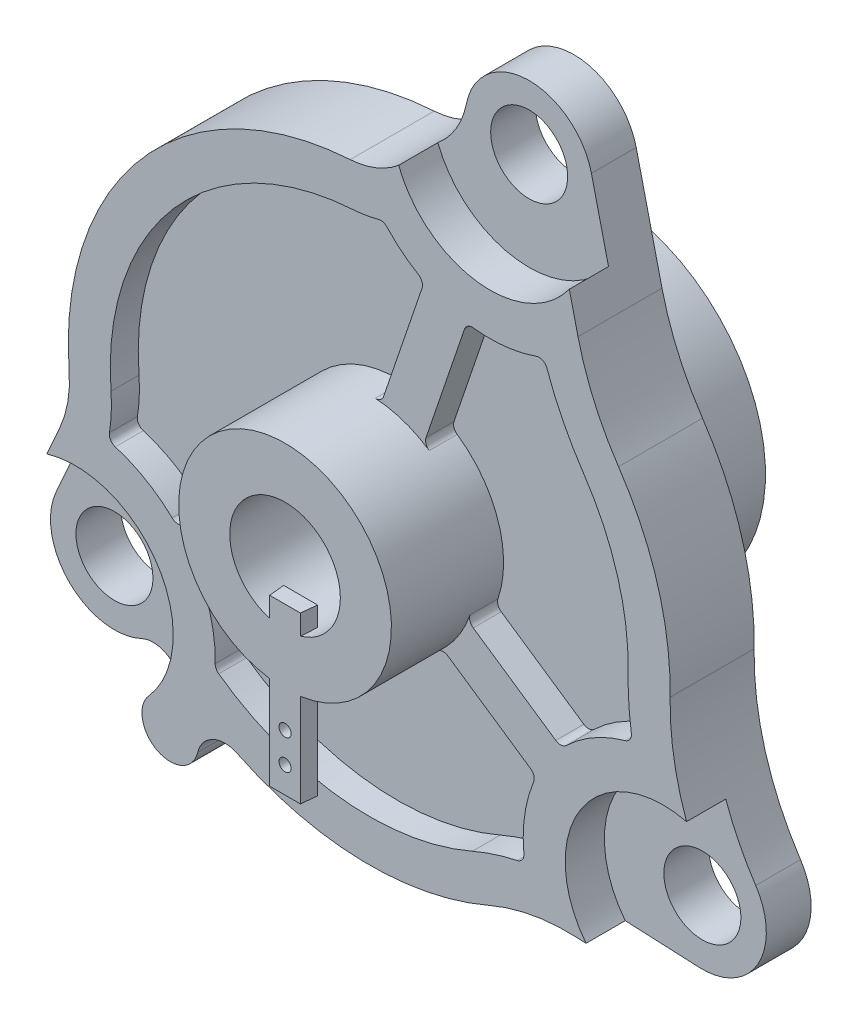
from build123d import *

# Parameters (mm, degrees)
EXTRUDE_START           = -5.08
EXTRUDE_1_OUTLINE_R     = 5.0165
EXTRUDE_1_DEPTH         = 5.08
EXTRUDE_1_2_OUTLINE_R   = 14.588011588
EXTRUDE_1_2_OUTLINE_R_2 = 2.268804718
EXTRUDE_1_2_OUTLINE_R_3 = 5.0165
EXTRUDE_1_2_OUTLINE_R_4 = 1.7
EXTRUDE_1_2_DEPTH       = 13.745
EXTRUDE_START_2         = -7.62
EXTRUDE_1_3_OUTLINE_R   = 5.0165
EXTRUDE_1_3_DEPTH       = 2.54
EXTRUDE_START_3         = -15.255
EXTRUDE_1_4_OUTLINE_R   = 9.652
EXTRUDE_1_4_OUTLINE_R_2 = 5.0165
EXTRUDE_1_4_DEPTH       = 7.635
EXTRUDE_START_4         = -4.064
EXTRUDE_1_5_OUTLINE_R   = 3.4925
EXTRUDE_1_5_DEPTH       = 4.064
SKETCH_2_R              = 3.139837575
SKETCH_2_R_2            = 1.7
EXTRUDE_2_DEPTH         = 13.745
SKETCH_3_R              = 1.2
CUT_EXTRUDE_1_DEPTH     = 2
SKETCH_4_R              = 2.8
SKETCH_4_R_2            = 1.7
EXTRUDE_3_DEPTH         = 3
CUT_EXTRUDE_2_DEPTH     = 11
EXTRUDE_4_DEPTH         = 7
EXTRUDE_4_DEPTH_BACK    = 8
SKETCH_8_R              = 0.55
CUT_EXTRUDE_3_DEPTH     = 7


with BuildPart() as part:
    # 凸台-拉伸1: read off the stored shape, not the designer's step
    # 凸台-拉伸1 outline → 凸台-拉伸1 (new body)
    with BuildSketch(Plane(origin=(0, 0, 0), x_dir=(-1, 0, 0), z_dir=(0, 0, -1)).offset(EXTRUDE_START)):
        with BuildLine():
            ThreePointArc((20.001041548, -24.024868384), (19.189851545, -13.342229592), (29.241937464, -9.636508412))
            Line((29.241937464, -9.636508412), (28.068905544, -6.994505511))
            ThreePointArc((28.068905544, -6.994505511), (27.342210837, -4.596155707), (27.224673499, -2.092887453))
            ThreePointArc((27.224673499, -2.092887453), (20.610396453, 17.910180989), (1.725707135, 27.250412105))
            ThreePointArc((1.725707135, 27.250412105), (-0.612060573, 27.775940536), (-2.671053319, 29.001455474))
            ThreePointArc((-2.671053319, 29.001455474), (-9.820841475, 23.407165066), (-18.154679086, 27.007540952))
            Line((-18.154679086, 27.007540952), (-18.943472312, 23.673588932))
            ThreePointArc((-18.943472312, 23.673588932), (-20.401103388, 19.31706117), (-22.619598737, 15.294338102))
            ThreePointArc((-22.619598737, 15.294338102), (-26.177171365, 7.766513011), (-27.300719551, -0.483463539))
            ThreePointArc((-27.300719551, -0.483463539), (-27.635164342, -5.065694963), (-28.789587413, -9.512717058))
            ThreePointArc((-28.789587413, -9.512717058), (-19.201342403, -13.324384855), (-19.674042111, -23.631654559))
            Line((-19.674042111, -23.631654559), (-18.789002246, -23.590560073))
            ThreePointArc((-18.789002246, -23.590560073), (-14.751162948, -23.864172006), (-10.879801534, -25.043820467))
            ThreePointArc((-10.879801534, -25.043820467), (0.599616353, -27.298415434), (11.968964894, -24.54194174))
            ThreePointArc((11.968964894, -24.54194174), (14.170803819, -24.529943899), (15.554698359, -26.242566013))
            ThreePointArc((15.554698359, -26.242566013), (18.332802908, -28.204355062), (20.616984936, -25.68463412))
            ThreePointArc((20.616984936, -25.68463412), (20.463088042, -24.797573692), (20.001041548, -24.024868384))
        make_face()
        Circle(EXTRUDE_1_OUTLINE_R, mode=Mode.SUBTRACT)
    extrude(amount=EXTRUDE_1_DEPTH)

    # Extrude 1 2 outline → Extrude 1 2 (add)
    with BuildSketch(Plane(origin=(0, 0, 0), x_dir=(-1, 0, 0), z_dir=(0, 0, -1))):
        Circle(EXTRUDE_1_2_OUTLINE_R)
        with Locations((-9.916654285, 0)):
            Circle(EXTRUDE_1_2_OUTLINE_R_2, mode=Mode.SUBTRACT)
        Circle(EXTRUDE_1_2_OUTLINE_R_3, mode=Mode.SUBTRACT)
        with Locations((9.916654285, 0)):
            Circle(EXTRUDE_1_2_OUTLINE_R_4, mode=Mode.SUBTRACT)
    extrude(amount=EXTRUDE_1_2_DEPTH)

    # Extrude 1 3 outline → Extrude 1 3 (add)
    with BuildSketch(Plane(origin=(0, 0, 0), x_dir=(-1, 0, 0), z_dir=(0, 0, -1)).offset(EXTRUDE_START_2)):
        with BuildLine():
            ThreePointArc((20.001041548, -24.024868384), (19.189851545, -13.342229592), (29.241937464, -9.636508412))
            Line((29.241937464, -9.636508412), (28.068905544, -6.994505511))
            ThreePointArc((28.068905544, -6.994505511), (27.342210837, -4.596155707), (27.224673499, -2.092887453))
            ThreePointArc((27.224673499, -2.092887453), (20.610396453, 17.910180989), (1.725707135, 27.250412105))
            ThreePointArc((1.725707135, 27.250412105), (-0.612060573, 27.775940536), (-2.671053319, 29.001455474))
            ThreePointArc((-2.671053319, 29.001455474), (-9.820841475, 23.407165066), (-18.154679086, 27.007540952))
            Line((-18.154679086, 27.007540952), (-18.943472312, 23.673588932))
            ThreePointArc((-18.943472312, 23.673588932), (-20.401103388, 19.31706117), (-22.619598737, 15.294338102))
            ThreePointArc((-22.619598737, 15.294338102), (-26.177171365, 7.766513011), (-27.300719551, -0.483463539))
            ThreePointArc((-27.300719551, -0.483463539), (-27.635164342, -5.065694963), (-28.789587413, -9.512717058))
            ThreePointArc((-28.789587413, -9.512717058), (-19.201342403, -13.324384855), (-19.674042111, -23.631654559))
            Line((-19.674042111, -23.631654559), (-18.789002246, -23.590560073))
            ThreePointArc((-18.789002246, -23.590560073), (-14.751162948, -23.864172006), (-10.879801534, -25.043820467))
            ThreePointArc((-10.879801534, -25.043820467), (0.599616353, -27.298415434), (11.968964894, -24.54194174))
            ThreePointArc((11.968964894, -24.54194174), (14.170803819, -24.529943899), (15.554698359, -26.242566013))
            ThreePointArc((15.554698359, -26.242566013), (18.332802908, -28.204355062), (20.616984936, -25.68463412))
            ThreePointArc((20.616984936, -25.68463412), (20.463088042, -24.797573692), (20.001041548, -24.024868384))
        make_face()
        with BuildLine():
            Line((-9.437411967, -3.963488283), (-16.925432177, -9.058357516))
            ThreePointArc((-16.925432177, -9.058357516), (-17.41757272, -9.187708174), (-17.881401777, -8.978432009))
            ThreePointArc((-17.881401777, -8.978432009), (-20.369392498, -7.119448331), (-23.234189867, -5.919925851))
            ThreePointArc((-23.234189867, -5.919925851), (-23.66657971, -5.602168652), (-23.782330153, -5.07821021))
            ThreePointArc((-23.782330153, -5.07821021), (-23.543476187, -2.752933566), (-23.491316823, -0.41600351))
            ThreePointArc((-23.491316823, -0.41600351), (-22.524542802, 6.682813521), (-19.463375657, 13.160244413))
            ThreePointArc((-19.463375657, 13.160244413), (-17.583975546, 16.360762601), (-16.125595223, 19.773765426))
            ThreePointArc((-16.125595223, 19.773765426), (-15.736516696, 20.206674843), (-15.155334867, 20.23861769))
            ThreePointArc((-15.155334867, 20.23861769), (-12.339759376, 19.599936809), (-9.452686504, 19.613679036))
            ThreePointArc((-9.452686504, 19.613679036), (-8.956292025, 19.50175751), (-8.641029977, 19.102328233))
            Line((-8.641029977, 19.102328233), (-5.153233585, 8.844103551))
            ThreePointArc((-5.153233585, 8.844103551), (-5.151801591, 8.357776579), (-5.444820191, 7.96963218))
            ThreePointArc((-5.444820191, 7.96963218), (-9.153474063, 3.061864885), (-9.144158429, -3.089574506))
            ThreePointArc((-9.144158429, -3.089574506), (-9.143653777, -3.575903324), (-9.437411967, -3.963488283))
        make_face(mode=Mode.SUBTRACT)
        with BuildLine():
            ThreePointArc((-7.151258866, -7.323488283), (-6.682895498, -7.19252367), (-6.230707221, -7.371525726))
            ThreePointArc((-6.230707221, -7.371525726), (0, -9.652), (6.230707221, -7.371525726))
            ThreePointArc((6.230707221, -7.371525726), (6.682895498, -7.19252367), (7.151258866, -7.323488283))
            Line((7.151258866, -7.323488283), (14.639279076, -12.418357516))
            ThreePointArc((14.639279076, -12.418357516), (14.940264662, -12.828652024), (14.91587299, -13.336922575))
            ThreePointArc((14.91587299, -13.336922575), (14.177670379, -15.859049125), (13.97436048, -18.4791122))
            ThreePointArc((13.97436048, -18.4791122), (13.89467208, -18.838860561), (13.655503297, -19.119159362))
            ThreePointArc((13.655503297, -19.119159362), (2.466910188, -23.365131695), (-9.361689692, -21.54933389))
            ThreePointArc((-9.361689692, -21.54933389), (-11.36623515, -20.794349539), (-13.435727078, -20.241713106))
            ThreePointArc((-13.435727078, -20.241713106), (-13.891836222, -19.945284024), (-14.034051192, -19.420231022))
            ThreePointArc((-14.034051192, -19.420231022), (-14.101364036, -16.324420921), (-14.91587299, -13.336922575))
            ThreePointArc((-14.91587299, -13.336922575), (-14.940264662, -12.828652024), (-14.639279076, -12.418357516))
            Line((-14.639279076, -12.418357516), (-7.151258866, -7.323488283))
        make_face(mode=Mode.SUBTRACT)
        with BuildLine():
            Line((16.925432177, -9.058357516), (9.437411967, -3.963488283))
            ThreePointArc((9.437411967, -3.963488283), (9.143653777, -3.575903324), (9.144158429, -3.089574506))
            ThreePointArc((9.144158429, -3.089574506), (7.680637088, 5.845418541), (-0.541368686, 9.636805692))
            ThreePointArc((-0.541368686, 9.636805692), (-1.010249862, 9.765904167), (-1.30554915, 10.152316259))
            Line((-1.30554915, 10.152316259), (-4.793345542, 20.410540941))
            ThreePointArc((-4.793345542, 20.410540941), (-4.786886375, 20.919355432), (-4.461586411, 21.310653068))
            ThreePointArc((-4.461586411, 21.310653068), (-2.953099663, 22.36336928), (-1.612513688, 23.62296165))
            ThreePointArc((-1.612513688, 23.62296165), (-1.26105352, 23.839608177), (-0.848188408, 23.841146693))
            ThreePointArc((-0.848188408, 23.841146693), (0.308161985, 23.584056969), (1.484910791, 23.44802902))
            ThreePointArc((1.484910791, 23.44802902), (17.73452718, 15.411085967), (23.425881848, -1.800856645))
            ThreePointArc((23.425881848, -1.800856645), (23.397483591, -3.467160777), (23.567714628, -5.124989875))
            ThreePointArc((23.567714628, -5.124989875), (23.461621487, -5.65215236), (23.033860973, -5.978000458))
            ThreePointArc((23.033860973, -5.978000458), (20.279055523, -7.17155875), (17.881401777, -8.978432009))
            ThreePointArc((17.881401777, -8.978432009), (17.41757272, -9.187708174), (16.925432177, -9.058357516))
        make_face(mode=Mode.SUBTRACT)
        Circle(EXTRUDE_1_3_OUTLINE_R, mode=Mode.SUBTRACT)
    extrude(amount=EXTRUDE_1_3_DEPTH)

    # Extrude 1 4 outline → Extrude 1 4 (add)
    with BuildSketch(Plane(origin=(0, 0, 0), x_dir=(-1, 0, 0), z_dir=(0, 0, -1)).offset(EXTRUDE_START_3)):
        Circle(EXTRUDE_1_4_OUTLINE_R)
        Circle(EXTRUDE_1_4_OUTLINE_R_2, mode=Mode.SUBTRACT)
    extrude(amount=EXTRUDE_1_4_DEPTH)

    # Extrude 1 5 outline → Extrude 1 5 (add)
    # profile 1 of 3: a face of its own
    with BuildSketch(Plane(origin=(0, 0, 0), x_dir=(-1, 0, 0), z_dir=(0, 0, -1)).offset(EXTRUDE_START_4)):
        with BuildLine():
            Line((31.974558392, -15.791151184), (29.241937464, -9.636508412))
            ThreePointArc((29.241937464, -9.636508412), (19.189851545, -13.342229592), (20.001041548, -24.024868384))
            ThreePointArc((20.001041548, -24.024868384), (20.463088042, -24.797573692), (20.616984936, -25.68463412))
            ThreePointArc((20.616984936, -25.68463412), (21.802856471, -23.565523811), (24.226273175, -23.410697217))
            ThreePointArc((24.226273175, -23.410697217), (30.739454478, -22.284551863), (31.974558392, -15.791151184))
        make_face()
        with Locations((26.67, -18.146340237)):
            Circle(EXTRUDE_1_5_OUTLINE_R, mode=Mode.SUBTRACT)
    # profile 2 of 3: a face of its own
    with BuildSketch(Plane(origin=(0, 0, 0), x_dir=(-1, 0, 0), z_dir=(0, 0, -1)).offset(EXTRUDE_START_4)):
        with BuildLine():
            ThreePointArc((-18.154679086, 27.007540952), (-9.820841475, 23.407165066), (-2.671053319, 29.001455474))
            ThreePointArc((-2.671053319, 29.001455474), (-4.34154767, 30.95941179), (-5.264931729, 33.361807717))
            ThreePointArc((-5.264931729, 33.361807717), (-10.854529977, 38.027365143), (-16.604256141, 33.560634381))
            Line((-16.604256141, 33.560634381), (-18.154679086, 27.007540952))
        make_face()
        with Locations((-10.956281429, 32.224357143)):
            Circle(EXTRUDE_1_5_OUTLINE_R, mode=Mode.SUBTRACT)
    # profile 3 of 3: a face of its own
    with BuildSketch(Plane(origin=(0, 0, 0), x_dir=(-1, 0, 0), z_dir=(0, 0, -1)).offset(EXTRUDE_START_4)):
        with BuildLine():
            Line((-26.400801283, -23.943993837), (-19.674042111, -23.631654559))
            ThreePointArc((-19.674042111, -23.631654559), (-19.201342403, -13.324384855), (-28.789587413, -9.512717058))
            ThreePointArc((-28.789587413, -9.512717058), (-29.987271524, -12.310373526), (-31.510952034, -14.944709618))
            ThreePointArc((-31.510952034, -14.944709618), (-31.716980405, -21.01221602), (-26.400801283, -23.943993837))
        make_face()
        with Locations((-26.67, -18.146340237)):
            Circle(EXTRUDE_1_5_OUTLINE_R, mode=Mode.SUBTRACT)
    extrude(amount=EXTRUDE_1_5_DEPTH)

    # 草图2 → 凸台-拉伸2 (add)
    with BuildSketch(Plane(origin=(0, 0, 0), x_dir=(-1, 0, 0), z_dir=(0, 0, -1))):
        with Locations((-9.916654285, 0)):
            Circle(SKETCH_2_R)
        with Locations(Location((-9.916654285, 0, 0), (0, 0, 180))):
            Circle(SKETCH_2_R_2, mode=Mode.SUBTRACT)
    extrude(amount=EXTRUDE_2_DEPTH)

    # 草图3 → 切除-拉伸1 (cut)
    with BuildSketch(Plane(origin=(0, 0, -13.745), x_dir=(-1, 0, 0), z_dir=(0, 0, -1))):
        with Locations((8.32907413, -5.382058747)):
            Circle(SKETCH_3_R)
        with Locations(Location((8.32907413, 5.382058747, 0), (0, 0, 180))):
            Circle(SKETCH_3_R)
    extrude(amount=-CUT_EXTRUDE_1_DEPTH, mode=Mode.SUBTRACT)

    # 草图4 → 凸台-拉伸3 (add)
    with BuildSketch(Plane(origin=(0, 0, -13.745), x_dir=(-1, 0, 0), z_dir=(0, 0, -1))):
        with Locations(Location((9.916654285, 0, 0), (0, 0, 180))):
            Circle(SKETCH_4_R)
        with Locations(Location((9.916654285, 0, 0), (0, 0, 180))):
            Circle(SKETCH_4_R_2, mode=Mode.SUBTRACT)
    extrude(amount=EXTRUDE_3_DEPTH)

    # 草图6 → 切除-拉伸2 (cut)
    with BuildSketch(Plane(origin=(0, -10, 0), x_dir=(1, 0, 0), z_dir=(0, 1, 0))):
        Polygon((-1.359530584, -15.591838783), (-1.541130969, -13.841585593), (1.541130969, -13.841585593), (1.359530584, -15.591838783), align=None)
    extrude(amount=CUT_EXTRUDE_2_DEPTH, mode=Mode.SUBTRACT)

    # 草图7 → 凸台-拉伸4 (add, two sides: drawn at the far end of the back side and taken through both)
    with BuildSketch(Plane(origin=(0, -10, 0), x_dir=(1, 0, 0), z_dir=(0, 1, 0)).offset(-EXTRUDE_4_DEPTH_BACK)):
        Polygon((-1.541130969, -13.841585593), (1.541130969, -13.841585593), (1.394479843, -15.255), (-1.394479843, -15.255), align=None)
    extrude(amount=EXTRUDE_4_DEPTH + EXTRUDE_4_DEPTH_BACK)

    # 草图8 → 切除-拉伸3 (cut)
    with BuildSketch(Plane.XY.offset(15.255)):
        with Locations((0, -12.900137164)):
            Circle(SKETCH_8_R)
        with Locations((0, -15.629883201)):
            Circle(SKETCH_8_R)
    extrude(amount=-CUT_EXTRUDE_3_DEPTH, mode=Mode.SUBTRACT)


solid = part.part
